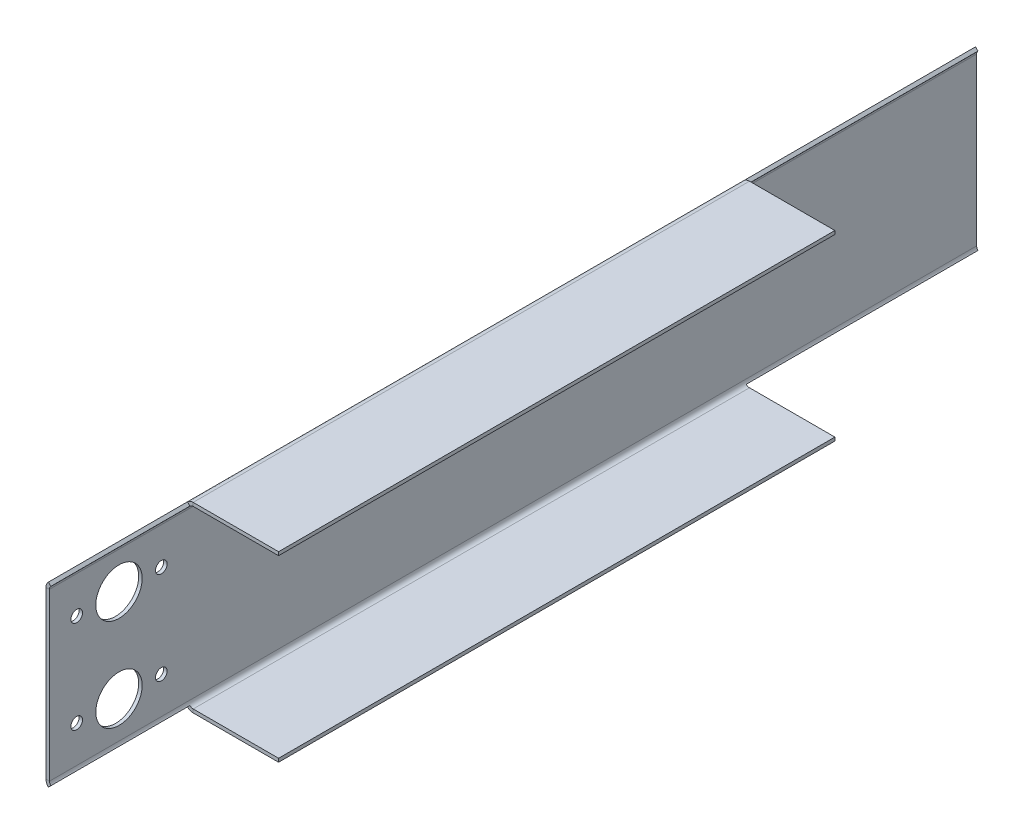
from build123d import *

# Parameters (mm, degrees)
ESBO_O3_W                = 400
ESBO_O3_H                = 154
RESSALTO_EXTRUS_O1_DEPTH = 1.5
ESBO_O10_W               = 60
ESBO_O10_H               = 39
ESBO_O10_W_2             = 100
CORTE_EXTRUS_O1_DEPTH    = 429.623669435
ESBO_O11_R               = 10
ESBO_O11_R_2             = 2.5
CORTE_EXTRUS_O2_DEPTH    = 429.623669435
DOBRA_START              = -400
DOBRA_ESBO_ADA1_DEPTH    = 400
DOBRA_ESBO_ADA1_2_DEPTH  = 100
DOBRA_START_2            = -60
DOBRA_ESBO_ADA1_3_DEPTH  = 60
DOBRA_START_3            = -300
DOBRA_ESBO_ADA1_4_DEPTH  = 240
DOBRA_ESBO_ADA1_5_DEPTH  = 400
DOBRA_ESBO_ADA2_DEPTH    = 400
DOBRA_ESBO_ADA2_2_DEPTH  = 100
DOBRA_ESBO_ADA2_3_DEPTH  = 60
DOBRA_ESBO_ADA2_4_DEPTH  = 240
DOBRA_ESBO_ADA2_5_DEPTH  = 400


# Read off the part's stored shape, not the designer's step: Transforma__o de esbo_o2, Dobra esbo_ada2
with BuildPart() as part:
    # Esboço3 → Ressalto-extrusão1 (new body)
    with BuildSketch(Plane(origin=(0, 0, 0), x_dir=(0, 0, -1), z_dir=(1, 0, 0))):
        with Locations((200, 77)):
            Rectangle(ESBO_O3_W, ESBO_O3_H)
    extrude(amount=RESSALTO_EXTRUS_O1_DEPTH)

    # Esboço10 → Corte-extrusão1 (cut, through all)
    with BuildSketch(Plane.ZY):
        with Locations((-30, 134.5)):
            Rectangle(ESBO_O10_W, ESBO_O10_H)
        with Locations((-350, 134.5)):
            Rectangle(ESBO_O10_W_2, ESBO_O10_H)
        with Locations((-350, 19.5)):
            Rectangle(ESBO_O10_W_2, ESBO_O10_H)
        with Locations((-30, 19.5)):
            Rectangle(ESBO_O10_W, ESBO_O10_H)
    extrude(amount=-CORTE_EXTRUS_O1_DEPTH, mode=Mode.SUBTRACT)

    # Esboço11 → Corte-extrusão2 (cut, through all)
    with BuildSketch(Plane(origin=(1.5, 0, 0), x_dir=(0, 0, -1), z_dir=(1, 0, 0))):
        with Locations((30, 57)):
            Circle(ESBO_O11_R)
        with Locations(Location((30, 97, 0), (0, 0, 180))):
            Circle(ESBO_O11_R)
        with Locations((11.75, 57)):
            Circle(ESBO_O11_R_2)
        with Locations((48.25, 57)):
            Circle(ESBO_O11_R_2)
        with Locations(Location((48.25, 97, 0), (0, 0, 180))):
            Circle(ESBO_O11_R_2)
        with Locations(Location((11.75, 97, 0), (0, 0, 180))):
            Circle(ESBO_O11_R_2)
    extrude(amount=-CORTE_EXTRUS_O2_DEPTH, mode=Mode.SUBTRACT)

    # Dobra esboçada1 outline → Dobra esboçada1 (cut)
    with BuildSketch(Plane.XY.offset(DOBRA_START)):
        with BuildLine():
            Line((1.5, 0), (1.5, 38.287563626))
            ThreePointArc((1.5, 38.287563626), (0.397581589, 39.539659775), (0, 41.159844949))
            Line((0, 41.159844949), (0, 0))
            Line((0, 0), (1.5, 0))
        make_face()
    extrude(amount=DOBRA_ESBO_ADA1_DEPTH, mode=Mode.SUBTRACT)

    # Dobra esbo_ada1 2 outline → Dobra esbo_ada1 2 (cut)
    with BuildSketch(Plane.XY.offset(DOBRA_START)):
        Polygon((1.5, 39), (1.5, 39.159844949), (1.340155051, 39), align=None)
    extrude(amount=DOBRA_ESBO_ADA1_2_DEPTH, mode=Mode.SUBTRACT)

    # Dobra esbo_ada1 3 outline → Dobra esbo_ada1 3 (cut)
    with BuildSketch(Plane.XY.offset(DOBRA_START_2)):
        Polygon((1.5, 39), (1.5, 39.159844949), (1.340155051, 39), align=None)
    extrude(amount=DOBRA_ESBO_ADA1_3_DEPTH, mode=Mode.SUBTRACT)

    # Dobra esbo_ada1 4 outline → Dobra esbo_ada1 4 (add)
    with BuildSketch(Plane.XY.offset(DOBRA_START_3)):
        with BuildLine():
            Line((40.340155051, 39.159844949), (3.5, 39.159844949))
            ThreePointArc((3.5, 39.159844949), (2.085786438, 39.745631387), (1.5, 41.159844949))
            Line((1.5, 41.159844949), (1.5, 38.287563626))
            ThreePointArc((1.5, 38.287563626), (2.451902827, 37.820459929), (3.5, 37.659844949))
            Line((3.5, 37.659844949), (40.340155051, 37.659844949))
            Line((40.340155051, 37.659844949), (40.340155051, 39.159844949))
        make_face()
    extrude(amount=DOBRA_ESBO_ADA1_4_DEPTH)

    # Dobra esbo_ada1 5 outline → Dobra esbo_ada1 5 (add)
    with BuildSketch(Plane.XY.offset(DOBRA_START)):
        with BuildLine():
            Line((1.5, 39.159844949), (2.085786438, 39.745631387))
            ThreePointArc((2.085786438, 39.745631387), (1.652240935, 40.394478084), (1.5, 41.159844949))
            Line((1.5, 41.159844949), (1.5, 39.159844949))
        make_face()
        with BuildLine():
            Line((1.025126266, 38.684971215), (1.340155051, 39))
            Line((1.340155051, 39), (0.745899458, 39))
            ThreePointArc((0.745899458, 39), (0.880772294, 38.838283789), (1.025126266, 38.684971215))
        make_face()
    extrude(amount=DOBRA_ESBO_ADA1_5_DEPTH)

    # Dobra esboçada2 outline → Dobra esboçada2 (cut)
    with BuildSketch(Plane.XY.offset(DOBRA_START)):
        with BuildLine():
            Line((1.5, 115.712436374), (1.5, 154))
            Line((1.5, 154), (0, 154))
            Line((0, 154), (0, 112.840155051))
            ThreePointArc((0, 112.840155051), (0.397581589, 114.460340225), (1.5, 115.712436374))
        make_face()
    extrude(amount=DOBRA_ESBO_ADA2_DEPTH, mode=Mode.SUBTRACT)

    # Dobra esbo_ada2 2 outline → Dobra esbo_ada2 2 (cut)
    with BuildSketch(Plane.XY.offset(DOBRA_START)):
        Polygon((1.5, 114.840155051), (1.5, 115), (1.340155051, 115), align=None)
    extrude(amount=DOBRA_ESBO_ADA2_2_DEPTH, mode=Mode.SUBTRACT)

    # Dobra esbo_ada2 3 outline → Dobra esbo_ada2 3 (cut)
    with BuildSketch(Plane.XY.offset(DOBRA_START_2)):
        Polygon((1.5, 114.840155051), (1.5, 115), (1.340155051, 115), align=None)
    extrude(amount=DOBRA_ESBO_ADA2_3_DEPTH, mode=Mode.SUBTRACT)

    # Dobra esbo_ada2 4 outline → Dobra esbo_ada2 4 (add)
    with BuildSketch(Plane.XY.offset(DOBRA_START_3)):
        with BuildLine():
            Line((40.340155051, 114.840155051), (40.340155051, 116.340155051))
            Line((40.340155051, 116.340155051), (3.5, 116.340155051))
            ThreePointArc((3.5, 116.340155051), (2.451902827, 116.179540071), (1.5, 115.712436374))
            Line((1.5, 115.712436374), (1.5, 112.840155051))
            ThreePointArc((1.5, 112.840155051), (2.085786438, 114.254368613), (3.5, 114.840155051))
            Line((3.5, 114.840155051), (40.340155051, 114.840155051))
        make_face()
    extrude(amount=DOBRA_ESBO_ADA2_4_DEPTH)

    # Dobra esbo_ada2 5 outline → Dobra esbo_ada2 5 (add)
    with BuildSketch(Plane.XY.offset(DOBRA_START)):
        with BuildLine():
            ThreePointArc((1.5, 112.840155051), (1.652240935, 113.605521916), (2.085786438, 114.254368613))
            Line((2.085786438, 114.254368613), (1.5, 114.840155051))
            Line((1.5, 114.840155051), (1.5, 112.840155051))
        make_face()
        with BuildLine():
            Line((1.340155051, 115), (1.025126266, 115.315028785))
            ThreePointArc((1.025126266, 115.315028785), (0.880772294, 115.161716211), (0.745899458, 115))
            Line((0.745899458, 115), (1.340155051, 115))
        make_face()
    extrude(amount=DOBRA_ESBO_ADA2_5_DEPTH)


solid = part.part
